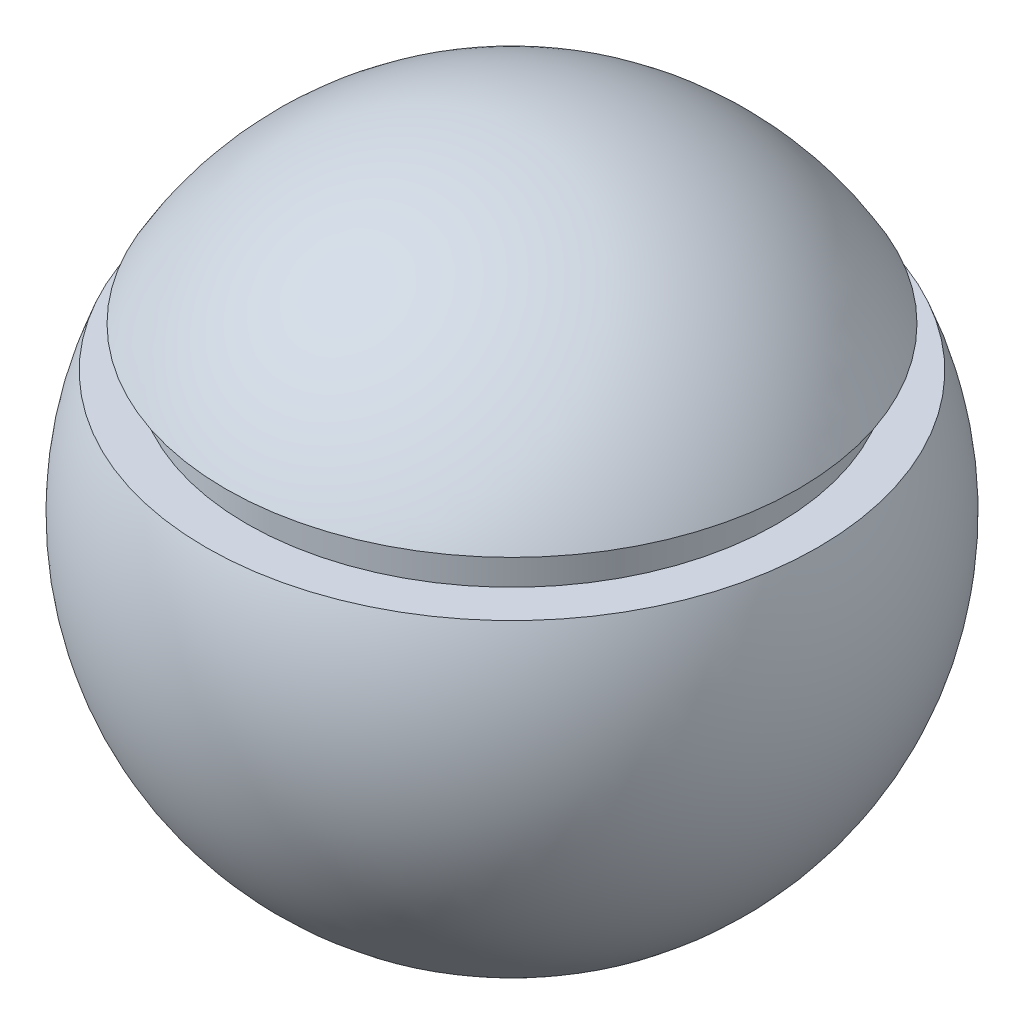
from build123d import *

# Parameters (mm, degrees)
SKETCH3_R          = 3.00000035
CUT_EXTRUDE1_DEPTH = 12.7
THREAD1_PITCH      = 1
SKETCH8_R          = 9.525
SKETCH8_R_2        = 8.255
CUT_EXTRUDE2_DEPTH = 1.27


with BuildPart() as part:
    # Sketch1 → Revolve1 (revolve)
    with BuildSketch(Plane.XY, mode=Mode.PRIVATE) as revolve1_sk:
        with BuildLine():
            Line((0, 3.81), (0, 10.258738958))
            ThreePointArc((0, 10.258738958), (-5.751344607, 8.494925557), (-9.525, 3.81))
            Line((-9.525, 3.81), (0, 3.81))
        make_face()
        with BuildLine():
            Line((0, -10.258738958), (0, 3.81))
            Line((0, 3.81), (-9.525, 3.81))
            ThreePointArc((-9.525, 3.81), (-8.494925557, -5.751344607), (0, -10.258738958))
        make_face()
    revolve(revolve1_sk.sketch.rotate(Axis((0, 10.258738958, 0), (0, -1, 0)), 180), axis=Axis((0, 10.258738958, 0), (0, -1, 0)))

    # Sketch3 → Cut-Extrude1 (cut)
    with BuildSketch(Plane(origin=(0, -10.258738958, 0), x_dir=(1, 0, 0), z_dir=(0, 1, 0))):
        with Locations(Location((0, 0, 0), (0, 0, 270))):
            Circle(SKETCH3_R)
    extrude(amount=CUT_EXTRUDE1_DEPTH, mode=Mode.SUBTRACT)

    # Thread1: the profile of Thread Profile1 profile screwed along a right-hand helix of 8.89 turns, 8 arcs to a turn; built about Z, then put on its axis
    thread1_z = Axis((0, 0, 0), (0, 0, 1))
    thread1_corners = [(3.00030035, 0, -0.000173205), (3.00030035, 0, 0.875173202), (2.458734475, 0, 0.562499999), (2.458734475, 0, 0.312499999)]
    with BuildLine(mode=Mode.PRIVATE) as thread1_profile:
        Line(thread1_corners[0], thread1_corners[1])
        Line(thread1_corners[1], thread1_corners[2])
        Line(thread1_corners[2], thread1_corners[3])
        Line(thread1_corners[3], thread1_corners[0])
    thread1_cap = Face(thread1_profile.wire())
    thread1_turn_angles = [0, 22.5, 45, 67.5, 90, 112.5, 135, 157.5, 180, 202.5, 225, 247.5, 270, 292.5, 315, 337.5, 360]
    thread1_turn_weights = [1, 0.9238795325112867, 1, 0.9238795325112867, 1, 0.9238795325112867, 1, 0.9238795325112867, 1, 0.9238795325112867, 1, 0.9238795325112867, 1, 0.9238795325112867, 1, 0.9238795325112867, 1]
    thread1_turn_rails = [Edge.make_bspline([Vector(p[0], p[1], 0).rotate(thread1_z, thread1_turn_angles[k]) / thread1_turn_weights[k] + Vector(0, 0, p[2] + THREAD1_PITCH * thread1_turn_angles[k] / 360) for k in range(17)], [0, 0, 0, 1, 1, 2, 2, 3, 3, 4, 4, 5, 5, 6, 6, 7, 7, 8, 8, 8], 2, thread1_turn_weights) for p in thread1_corners]
    thread1_turn_sides = [Face.make_surface_from_curves(thread1_turn_rails[p[0]], thread1_turn_rails[p[1]]) for p in [(0, 1), (1, 2), (2, 3), (3, 0)]]
    thread1_last_angles = [2880, 2902.5, 2925, 2947.5, 2970, 2992.5, 3015, 3037.5, 3060, 3082.5, 3105, 3127.5, 3150, 3172.5, 3195, 3197.7, 3200.4]
    thread1_last_weights = [1, 0.9238795325112867, 1, 0.9238795325112867, 1, 0.9238795325112867, 1, 0.9238795325112867, 1, 0.9238795325112867, 1, 0.9238795325112867, 1, 0.9238795325112867, 1, 0.9988898749619701, 1]
    thread1_last_rails = [Edge.make_bspline([Vector(p[0], p[1], 0).rotate(thread1_z, thread1_last_angles[k]) / thread1_last_weights[k] + Vector(0, 0, p[2] + THREAD1_PITCH * thread1_last_angles[k] / 360) for k in range(17)], [0, 0, 0, 1, 1, 2, 2, 3, 3, 4, 4, 5, 5, 6, 6, 7, 7, 8, 8, 8], 2, thread1_last_weights) for p in thread1_corners]
    thread1_last_sides = [Face.make_surface_from_curves(thread1_last_rails[p[0]], thread1_last_rails[p[1]]) for p in [(0, 1), (1, 2), (2, 3), (3, 0)]]
    thread1 = Plane(origin=(0, -9.810286586, 0), x_dir=(1, 0, 0), z_dir=(0, 1, 0)) * Solid(Shell([*[p.moved(Location((0, 0, THREAD1_PITCH * i))) for i in range(8) for p in thread1_turn_sides], *thread1_last_sides, thread1_cap, thread1_cap.rotate(thread1_z, 3200.4).moved(Location((0, 0, THREAD1_PITCH * 3200.4 / 360)))]))
    add(thread1)

    # Sketch8 → Cut-Extrude2 (cut)
    with BuildSketch(Plane(origin=(0, 3.81, 0), x_dir=(1, 0, 0), z_dir=(0, 1, 0))):
        Circle(SKETCH8_R)
        with Locations(Location((0, 0, 0), (0, 0, 270))):
            Circle(SKETCH8_R_2, mode=Mode.SUBTRACT)
    extrude(amount=CUT_EXTRUDE2_DEPTH, mode=Mode.SUBTRACT)


solid = part.part
